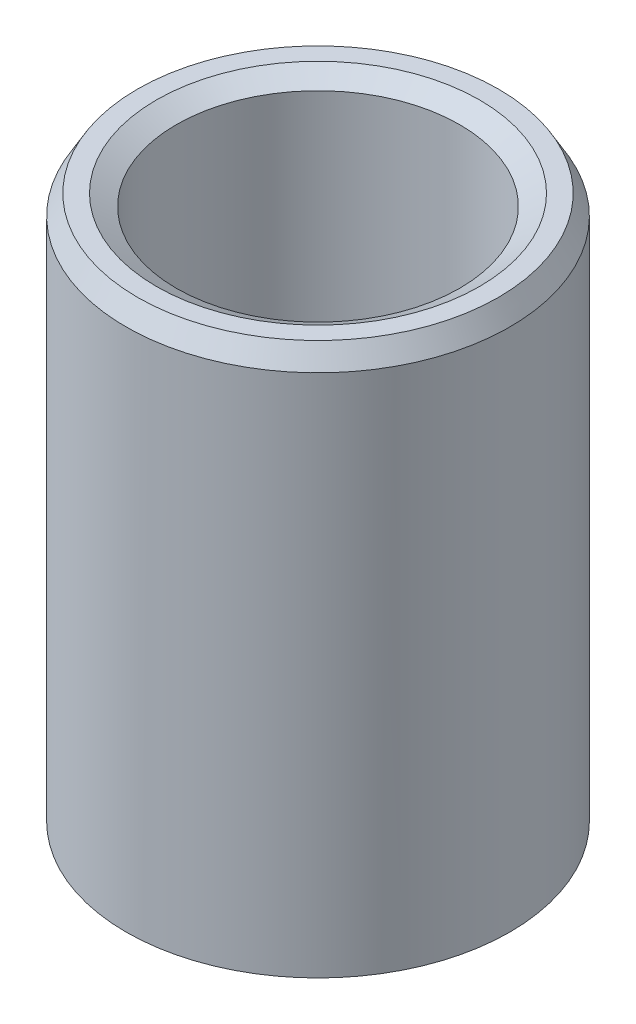
from build123d import *
from OCP.BRepFilletAPI import BRepFilletAPI_MakeChamfer

# Parameters (mm, degrees)
SKETCH1_R           = 27.5
BOSS_EXTRUDE1_DEPTH = 79.590028623
SKETCH2_R           = 20.310352763
CUT_EXTRUDE1_DEPTH  = 89.583704237
CHAMFER1_SIZE       = 2.844902352
CHAMFER1_SIZE2      = 1.642505139


with BuildPart() as part:
    # Sketch1 → Boss-Extrude1 (new body)
    with BuildSketch(Plane(origin=(0, 0, 0), x_dir=(1, 0, 0), z_dir=(0, 1, 0))):
        Circle(SKETCH1_R)
    extrude(amount=BOSS_EXTRUDE1_DEPTH)

    # Sketch2 → Cut-Extrude1 (cut, through all)
    with BuildSketch(Plane(origin=(0, 0, 0), x_dir=(1, 0, 0), z_dir=(0, 1, 0))):
        Circle(SKETCH2_R)
    extrude(amount=CUT_EXTRUDE1_DEPTH, mode=Mode.SUBTRACT)

    # Chamfer1: one chamfer whose edges measure the first distance from different faces: ONE call of the kernel's chamfer builder (chamfer() names one face for all edges)
    chamfer1_edges_1 = [part.edges().sort_by_distance(p)[0] for p in [
        (-20.310352763, 79.590028623, 0),
    ]]
    chamfer1_side_1 = [part.faces().sort_by_distance(p)[0] for p in [
        (-26.722182541, 79.590028623, 0),
    ]]
    chamfer1_edges_2 = [part.edges().sort_by_distance(p)[0] for p in [
        (-20.310352763, 0, 0),
    ]]
    chamfer1_side_2 = [part.faces().sort_by_distance(p)[0] for p in [
        (-20.310352763, 39.795014312, 0),
    ]]
    chamfer1_edges_3 = [part.edges().sort_by_distance(p)[0] for p in [
        (-27.5, 0, 0),
    ]]
    chamfer1_side_3 = [part.faces().sort_by_distance(p)[0] for p in [
        (-26.722182541, 0, 0),
    ]]
    chamfer1_edges_4 = [part.edges().sort_by_distance(p)[0] for p in [
        (-27.5, 79.590028623, 0),
    ]]
    chamfer1_side_4 = [part.faces().sort_by_distance(p)[0] for p in [
        (-27.5, 39.795014312, 0),
    ]]
    chamfer1 = BRepFilletAPI_MakeChamfer(part.part.solid().wrapped)
    for e in chamfer1_edges_1:
        chamfer1.Add(CHAMFER1_SIZE, CHAMFER1_SIZE2, e.wrapped, chamfer1_side_1[0].wrapped)  # the first distance lies on this face
    for e in chamfer1_edges_2:
        chamfer1.Add(CHAMFER1_SIZE, CHAMFER1_SIZE2, e.wrapped, chamfer1_side_2[0].wrapped)  # the first distance lies on this face
    for e in chamfer1_edges_3:
        chamfer1.Add(CHAMFER1_SIZE, CHAMFER1_SIZE2, e.wrapped, chamfer1_side_3[0].wrapped)  # the first distance lies on this face
    for e in chamfer1_edges_4:
        chamfer1.Add(CHAMFER1_SIZE, CHAMFER1_SIZE2, e.wrapped, chamfer1_side_4[0].wrapped)  # the first distance lies on this face
    add(Compound.cast(chamfer1.Shape()), mode=Mode.REPLACE)


solid = part.part
